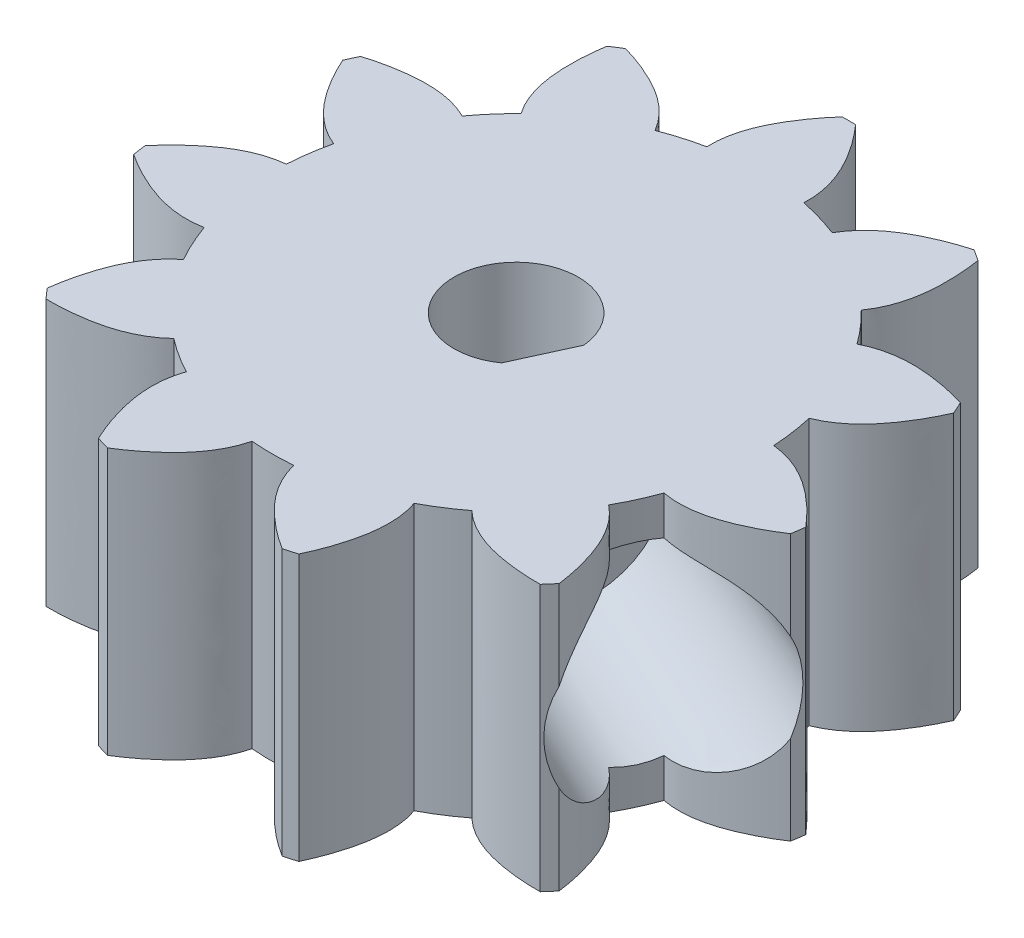
from build123d import *

# Parameters (mm, degrees)
SKETCH1_R           = 6.985
BOSS_EXTRUDE1_DEPTH = 7.62
CIRPATTERN1_COUNT   = 11
CUT_EXTRUDE1_DEPTH  = 16.43236868


# Read off the part's stored shape, not the designer's step: Cut-Extrude2
with BuildPart() as part:
    # Sketch1 → Boss-Extrude1 (new body)
    with BuildSketch(Plane(origin=(0, 0, 0), x_dir=(1, 0, 0), z_dir=(0, 1, 0))):
        Circle(SKETCH1_R)
        with BuildLine():
            add(Edge.make_bspline(
                [(1.387604422, 6.84578549), (1.423643939, 7.597190899), (0.984603354, 8.544581789), (0.361474483, 9.332383529), (0.192044664, 9.523063785)],
                knots=[0, 0, 0, 0, 0.250134969, 0.335748037, 0.335748037, 0.335748037, 0.335748037], degree=3))
            ThreePointArc((0.192044664, 9.523063785), (0, 9.525), (-0.192044664, 9.523063785))
            add(Edge.make_bspline(
                [(-1.387604422, 6.84578549), (-1.423643939, 7.597190899), (-0.984603354, 8.544581789), (-0.361474483, 9.332383529), (-0.192044664, 9.523063785)],
                knots=[0, 0, 0, 0, 0.250134969, 0.335748037, 0.335748037, 0.335748037, 0.335748037], degree=3))
            ThreePointArc((-1.387604422, 6.84578549), (0, 6.985), (1.387604422, 6.84578549))
        make_face()
    boss_extrude1 = extrude(amount=BOSS_EXTRUDE1_DEPTH)

    # CirPattern1: Boss-Extrude1 ×11 about axis
    cirpattern1_axis = Axis((0, 7.62, 0), (0, -1, 0))
    for i in range(1, CIRPATTERN1_COUNT):
        add(boss_extrude1.rotate(cirpattern1_axis, i * 360 / CIRPATTERN1_COUNT))

    # Sketch2 → Cut-Extrude1 (cut, through all)
    with BuildSketch(Plane(origin=(0, 7.62, 0), x_dir=(1, 0, 0), z_dir=(0, 1, 0))):
        with BuildLine():
            Line((1.769949078, 0.169009645), (1.031341185, -1.448316043))
            ThreePointArc((1.031341185, -1.448316043), (-1.617325688, 0.738607893), (1.769949078, 0.169009645))
        make_face()
    extrude(amount=-CUT_EXTRUDE1_DEPTH, mode=Mode.SUBTRACT)

    # Cut-Extrude2 outline → Cut-Extrude2 (revolve, cut)
    with BuildSketch(Plane(origin=(0, 3.81, 0), x_dir=(0, 1, 0), z_dir=(0.41541501300188993, 0, -0.9096319953545169))):
        Polygon((0, 1.539793168), (2.667, 1.539793168), (2.800559609, 9.191418023), (0, 9.191418023), align=None)
    revolve(axis=Axis((0, 3.81, 0), (0.9096319953545169, 0, 0.41541501300188993)), mode=Mode.SUBTRACT)


solid = part.part
